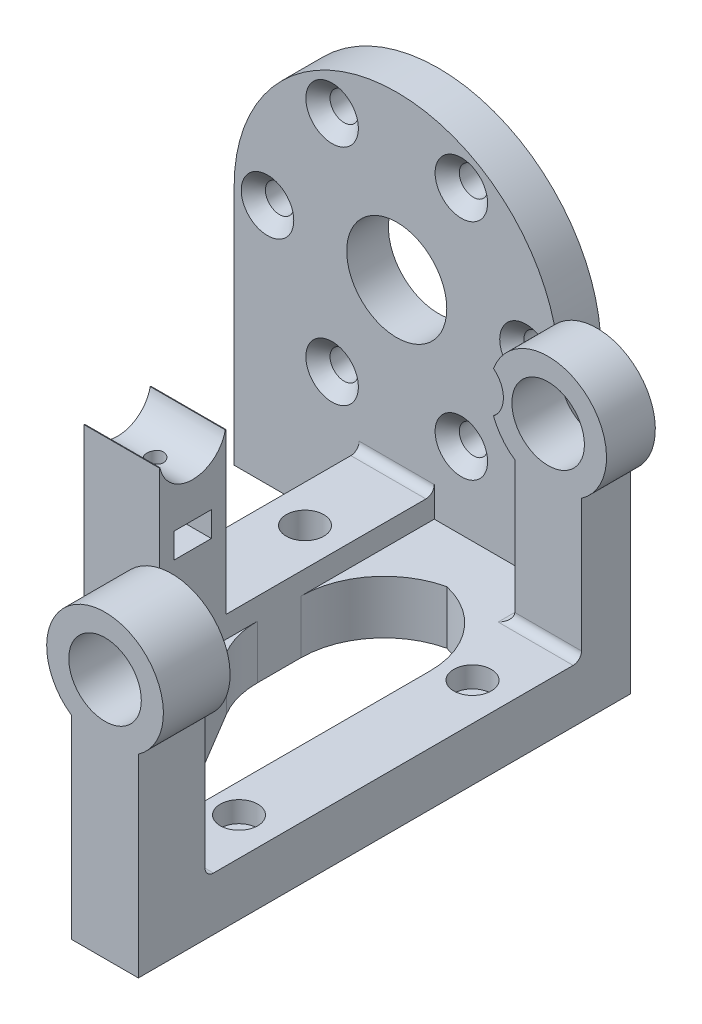
from build123d import *

# Parameters (mm, degrees)
SKETCH5_R                                       = 19.5
SKETCH5_R_2                                     = 1.5
SKETCH5_R_3                                     = 6
BOSS_EXTRUDE1_DEPTH                             = 5
CSK_FOR_M3_FLAT_HEAD_MACHINE_SCREW1_D           = 3.4
CSK_FOR_M3_FLAT_HEAD_MACHINE_SCREW1_CSINK_D     = 6.3
CSK_FOR_M3_FLAT_HEAD_MACHINE_SCREW1_CSINK_ANGLE = 90
BOSS_EXTRUDE2_START                             = -5
BOSS_EXTRUDE2_DEPTH                             = 5
SKETCH9_W                                       = 9
SKETCH9_H                                       = 5
BOSS_EXTRUDE3_DEPTH                             = 32.98166783
SKETCH10_W                                      = 9
SKETCH10_H                                      = 8
BOSS_EXTRUDE4_DEPTH                             = 24
CUT_EXTRUDE1_DEPTH                              = 20
SKETCH12_R                                      = 1
CUT_EXTRUDE2_DEPTH                              = 16
CUT_EXTRUDE3_START                              = -9
SKETCH13_W                                      = 4.5
SKETCH13_H                                      = 3
CUT_EXTRUDE3_DEPTH                              = 9
BOSS_EXTRUDE5_DEPTH                             = 2.4
SKETCH15_W                                      = 8
SKETCH15_H                                      = 26.6
BOSS_EXTRUDE6_DEPTH                             = 8
CUT_EXTRUDE4_REACH                              = 76.201
CUT_EXTRUDE5_REACH                              = 83.567
SKETCH17_W                                      = 8
SKETCH17_H                                      = 3
BOSS_EXTRUDE7_DEPTH                             = 2.4
FILLET1_R                                       = 10
FILLET2_R                                       = 1
FILLET3_R                                       = 1
BOSS_EXTRUDE8_START                             = -5.858134929
BOSS_EXTRUDE8_DEPTH                             = 5.858134929
BOSS_EXTRUDE9_DEPTH                             = 8
CUT_EXTRUDE9_REACH                              = 77.385
SKETCH26_R                                      = 4.35
BOSS_EXTRUDE10_START                            = 4
BOSS_EXTRUDE10_DEPTH                            = 4
SKETCH28_R                                      = 1
CUT_EXTRUDE10_DEPTH                             = 83.645869552
SKETCH29_R                                      = 2.25
CUT_EXTRUDE11_DEPTH                             = 2.5
SKETCH30_R                                      = 1
CUT_EXTRUDE12_DEPTH                             = 82.352195754
SKETCH31_R                                      = 2.25
CUT_EXTRUDE13_DEPTH                             = 5


with BuildPart() as part:
    # Sketch5 → Boss-Extrude1 (new body)
    with BuildSketch(Plane.XY):
        Circle(SKETCH5_R)
        with Locations((-7.75, 13.423393759)):
            Circle(SKETCH5_R_2, mode=Mode.SUBTRACT)
        Circle(SKETCH5_R_3, mode=Mode.SUBTRACT)
        with Locations((7.75, 13.423393759)):
            Circle(SKETCH5_R_2, mode=Mode.SUBTRACT)
        with Locations((15.5, 0)):
            Circle(SKETCH5_R_2, mode=Mode.SUBTRACT)
        with Locations((7.75, -13.423393759)):
            Circle(SKETCH5_R_2, mode=Mode.SUBTRACT)
        with Locations((-7.75, -13.423393759)):
            Circle(SKETCH5_R_2, mode=Mode.SUBTRACT)
        with Locations((-15.5, 0)):
            Circle(SKETCH5_R_2, mode=Mode.SUBTRACT)
    extrude(amount=BOSS_EXTRUDE1_DEPTH)

    # CSK for M3 Flat Head Machine Screw1 (through all)
    with Locations(Plane.XY.offset(5)):
        with Locations((-15.5, 0), (-7.75, 13.423393759), (7.75, 13.423393759), (15.5, 0), (7.75, -13.423393759), (-7.75, -13.423393759)):
            CounterSinkHole(CSK_FOR_M3_FLAT_HEAD_MACHINE_SCREW1_D / 2, CSK_FOR_M3_FLAT_HEAD_MACHINE_SCREW1_CSINK_D / 2, counter_sink_angle=CSK_FOR_M3_FLAT_HEAD_MACHINE_SCREW1_CSINK_ANGLE)

    # Sketch8 → Boss-Extrude2 (add)
    with BuildSketch(Plane.XY.offset(5).offset(BOSS_EXTRUDE2_START)):
        with BuildLine():
            Line((-19.5, 0), (-19.5, -25))
            Line((-19.5, -25), (19.5, -25))
            Line((19.5, -25), (19.5, 0))
            ThreePointArc((19.5, 0), (0, -19.5), (-19.5, 0))
        make_face()
    extrude(amount=BOSS_EXTRUDE2_DEPTH)

    # Sketch9 → Boss-Extrude3 (add)
    with BuildSketch(Plane.XY.offset(5)):
        with Locations((0, -22.5)):
            Rectangle(SKETCH9_W, SKETCH9_H)
    extrude(amount=BOSS_EXTRUDE3_DEPTH)

    # Sketch10 → Boss-Extrude4 (add)
    with BuildSketch(Plane(origin=(0.371235249, -20, 0), x_dir=(1, 0, 0), z_dir=(0, 1, 0))):
        with Locations((-0.371235249, -33.98166783)):
            Rectangle(SKETCH10_W, SKETCH10_H)
    extrude(amount=BOSS_EXTRUDE4_DEPTH)

    # Sketch11 → Cut-Extrude1 (cut)
    with BuildSketch(Plane.ZY.offset(4.5)):
        with BuildLine():
            Line((29.98166783, 0), (27.136883472, 2.082164772))
            Line((27.136883472, 2.082164772), (27.357366889, 4.848229459))
            Line((27.357366889, 4.848229459), (32.749188635, 5.469591817))
            Line((32.749188635, 5.469591817), (41.448261638, 5.028624983))
            Line((41.448261638, 5.028624983), (40.823718291, 2.383004911))
            Line((40.823718291, 2.383004911), (37.98166783, 0))
            Line((37.98166783, 0), (37.98166783, -0.8))
            Line((37.98166783, -0.8), (37.900851418, -0.8))
            ThreePointArc((37.900851418, -0.8), (33.98166783, -4), (30.062484242, -0.8))
            Line((30.062484242, -0.8), (29.98166783, -0.8))
            Line((29.98166783, -0.8), (29.98166783, 0))
        make_face()
    extrude(amount=-CUT_EXTRUDE1_DEPTH, mode=Mode.SUBTRACT)

    # Sketch12 → Cut-Extrude2 (cut)
    with BuildSketch(Plane(origin=(0, -0.8, 0), x_dir=(1, 0, 0), z_dir=(0, 1, 0))):
        with Locations(Location((0, -33.98166783, 0), (0, 0, 180))):
            Circle(SKETCH12_R)
    extrude(amount=-CUT_EXTRUDE2_DEPTH, mode=Mode.SUBTRACT)

    # Sketch13 → Cut-Extrude3 (cut)
    with BuildSketch(Plane.ZY.offset(4.5).offset(CUT_EXTRUDE3_START)):
        with Locations((33.98166783, -9.74430731)):
            Rectangle(SKETCH13_W, SKETCH13_H)
    extrude(amount=CUT_EXTRUDE3_DEPTH, mode=Mode.SUBTRACT)

    # Sketch14 → Boss-Extrude5 (add)
    with BuildSketch(Plane.XZ.offset(25)):
        Polygon((4.5, 5), (28.014992407, 5), (28.014992407, 12.492055485), (28.014992407, 64), (20.014992407, 64), (20.014992407, 11), (4.5, 11), align=None)
    extrude(amount=-BOSS_EXTRUDE5_DEPTH)

    # Sketch15 → Boss-Extrude6 (add)
    with BuildSketch(Plane(origin=(28.014992407, 0, 0), x_dir=(0, 0, -1), z_dir=(1, 0, 0))):
        with Locations((-60, -9.3)):
            Rectangle(SKETCH15_W, SKETCH15_H)
        with Locations((-9, -9.3)):
            Rectangle(SKETCH15_W, SKETCH15_H)
    extrude(amount=-BOSS_EXTRUDE6_DEPTH)

    # Cut-Extrude4: up to this face of the body (flat: up to its plane)
    cut_extrude4_end = Plane(part.part.faces().sort_by_distance((23.992430761, -10.570480367, 5))[0])
    # Sketch16 → Cut-Extrude4 (cut, up to the picked face)
    with BuildSketch(Plane.XY.offset(64), mode=Mode.PRIVATE) as cut_extrude4_sk1:
        with BuildLine():
            Line((20.014992407, -1.0579315), (20.157430879, -1.0579315))
            ThreePointArc((20.157430879, -1.0579315), (24.014992407, -4), (27.872553935, -1.0579315))
            Line((27.872553935, -1.0579315), (28.014992407, -1.0579315))
            Line((28.014992407, -1.0579315), (30.979685938, 0.908889408))
            Line((30.979685938, 0.908889408), (30.041869507, 7.8055779))
            Line((30.041869507, 7.8055779), (20.014992407, 9.247594016))
            Line((20.014992407, 9.247594016), (20.014992407, -1.0579315))
        make_face()
    cut_extrude4_tool1 = split(extrude(cut_extrude4_sk1.sketch, amount=-CUT_EXTRUDE4_REACH, mode=Mode.PRIVATE), bisect_by=cut_extrude4_end, keep=Keep.BOTH, mode=Mode.PRIVATE)
    add(cut_extrude4_tool1.solids().sort_by(Axis((24.887523, 2.893806, 64), (0, 0, -1)))[0], mode=Mode.SUBTRACT)

    # Cut-Extrude5: up to this face of the body (flat: up to its plane)
    cut_extrude5_end = Plane(part.part.faces().sort_by_distance((20.086211643, -1.0579315, 9))[0])
    # Sketch17 → Cut-Extrude5 (cut, up to the picked face)
    with BuildSketch(Plane(origin=(0, -22.6, 0), x_dir=(1, 0, 0), z_dir=(0, 1, 0)), mode=Mode.PRIVATE) as cut_extrude5_sk1:
        with Locations((24.014992407, -12.358134929)):
            Rectangle(SKETCH17_W, SKETCH17_H)
    cut_extrude5_tool1 = split(extrude(cut_extrude5_sk1.sketch, amount=CUT_EXTRUDE5_REACH, mode=Mode.PRIVATE), bisect_by=cut_extrude5_end, keep=Keep.BOTH, mode=Mode.PRIVATE)
    add(cut_extrude5_tool1.solids().sort_by(Axis((24.014992, -22.6, 12.358135), (0, 1, 0)))[0], mode=Mode.SUBTRACT)

    # Sketch20 → Boss-Extrude7 (add)
    with BuildSketch(Plane(origin=(0, -22.6, 0), x_dir=(1, 0, 0), z_dir=(0, 1, 0))):
        Polygon((20.014992407, -64), (4.5, -37.98166783), (4.5, -28.98166783), (20.014992407, -55), align=None)
    extrude(amount=-BOSS_EXTRUDE7_DEPTH)

    # Fillet1
    # the kernel refuses this fillet: 10 mm, written as the material it adds along each edge
    with BuildSketch(Plane(origin=(4.5, -25, 11), x_dir=(0, 0, 1), z_dir=(0, 1, 0)), Plane(origin=(20.014992407, -25, 11), x_dir=(-1, 0, 0), z_dir=(0, 1, 0))) as fillet1_piece_1:
        with BuildLine():
            CenterArc((FILLET1_R, FILLET1_R), FILLET1_R, 180, 90)
            Line((0, FILLET1_R), (0, 0))
            Line((0, 0), (FILLET1_R, 0))
        make_face()
    extrude(amount=2.4)
    with BuildSketch(Plane(origin=(4.5, -22.6, 28.98166783), x_dir=(0, 0, -1), z_dir=(0, -1, 0))) as fillet1_piece_2:
        with BuildLine():
            CenterArc((FILLET1_R * 0.275521450238, FILLET1_R), FILLET1_R, 239.191952284, 30.808047716)
            Line((-FILLET1_R * 0.236642058357, FILLET1_R * 0.141112032647), (0, 0))
            Line((0, 0), (FILLET1_R * 0.275521450238, 0))
        make_face()
    extrude(amount=2.4)

    # Fillet2
    fillet2_edges = [part.edges().sort_by_distance(p)[0] for p in [
        (20.014992407, -23.8, 55),
    ]]
    fillet(fillet2_edges, radius=FILLET2_R)

    # Fillet3
    # the kernel refuses this fillet: 1 mm, written as the material it adds along each edge
    with BuildSketch(Plane(origin=(28.014992407, -22.6, 56), x_dir=(0, 0, -1), z_dir=(-1, 0, 0))) as fillet3_piece_1:
        with BuildLine():
            CenterArc((FILLET3_R, -FILLET3_R), FILLET3_R, 90, 90)
            Line((0, -FILLET3_R), (0, 0))
            Line((0, 0), (FILLET3_R, 0))
        make_face()
    extrude(amount=8)
    with BuildSketch(Plane(origin=(20.014992407, -22.6, 5), x_dir=(-1, 0, 0), z_dir=(0, 0, 1))) as fillet3_piece_2:
        with BuildLine():
            CenterArc((FILLET3_R, -FILLET3_R), FILLET3_R, 90, 90)
            Line((0, -FILLET3_R), (0, 0))
            Line((0, 0), (FILLET3_R, 0))
        make_face()
    extrude(amount=5.858134929)
    with BuildSketch(Plane(origin=(28.014992407, -22.6, 10.858134929), x_dir=(0, 0, 1), z_dir=(-1, 0, 0))) as fillet3_piece_3:
        with BuildLine():
            CenterArc((FILLET3_R, FILLET3_R), FILLET3_R, 180, 90)
            Line((0, FILLET3_R), (0, 0))
            Line((0, 0), (FILLET3_R, 0))
        make_face()
    extrude(amount=8)
    with BuildSketch(Plane(origin=(20.014992407, -22.6, 56), x_dir=(-1, 0, 0), z_dir=(0, 0, 1))) as fillet3_piece_4_section:
        with BuildLine():
            CenterArc((FILLET3_R, -FILLET3_R), FILLET3_R, 90, 90)
            Line((0, -FILLET3_R), (0, 0))
            Line((0, 0), (FILLET3_R, 0))
        make_face()
    fillet3_piece_4 = extrude(amount=8, mode=Mode.PRIVATE)
    fillet3_piece_4 = split(fillet3_piece_4, bisect_by=Plane(origin=(18.118657623, -22.367607941, 60.81988447), z_dir=(0.8588879673530325, 0, -0.5121635085948395)), keep=Keep.TOP, mode=Mode.PRIVATE)
    add(fillet3_piece_4)
    with BuildSketch(Plane(origin=(4.5, -20, 5), x_dir=(0, 1, 0), z_dir=(-1, 0, 0))) as fillet3_piece_5:
        with BuildLine():
            CenterArc((FILLET3_R, -FILLET3_R), FILLET3_R, 90, 90)
            Line((0, -FILLET3_R), (0, 0))
            Line((0, 0), (FILLET3_R, 0))
        make_face()
    extrude(amount=9)
    with BuildSketch(Plane(origin=(20.014992407, -22.6, 53.5), x_dir=(-1, 0, 0), z_dir=(0, 0, 1))) as fillet3_piece_6a_section:
        with BuildLine():
            CenterArc((FILLET3_R, -FILLET3_R), FILLET3_R, 90, 90)
            Line((0, -FILLET3_R), (0, 0))
            Line((0, 0), (FILLET3_R, 0))
        make_face()
    fillet3_piece_6a = extrude(amount=10.5, mode=Mode.PRIVATE)
    fillet3_piece_6a = split(fillet3_piece_6a, bisect_by=Plane(origin=(19.788597293, -22.373604886, 56), z_dir=(0, 0, -1)), keep=Keep.TOP, mode=Mode.PRIVATE)
    with BuildSketch(Plane(origin=(28.014992407, -22.6, 56), x_dir=(0, 0, -1), z_dir=(-1, 0, 0))) as fillet3_piece_6b_section:
        with BuildLine():
            CenterArc((FILLET3_R, -FILLET3_R), FILLET3_R, 90, 90)
            Line((0, -FILLET3_R), (0, 0))
            Line((0, 0), (FILLET3_R, 0))
        make_face()
    fillet3_piece_6b = extrude(amount=10.5, mode=Mode.PRIVATE)
    fillet3_piece_6b = split(fillet3_piece_6b, bisect_by=Plane(origin=(20.014992407, -22.373604886, 55.773604886), z_dir=(-1, 0, 0)), keep=Keep.TOP, mode=Mode.PRIVATE)
    fillet3_piece_6 = fillet3_piece_6a & fillet3_piece_6b
    add(fillet3_piece_6)
    with BuildSketch(Plane(origin=(20.014992407, -22.6, 5), x_dir=(-1, 0, 0), z_dir=(0, 0, 1))) as fillet3_piece_7a_section:
        with BuildLine():
            CenterArc((FILLET3_R, -FILLET3_R), FILLET3_R, 90, 90)
            Line((0, -FILLET3_R), (0, 0))
            Line((0, 0), (FILLET3_R, 0))
        make_face()
    fillet3_piece_7a = extrude(amount=8.358134929, mode=Mode.PRIVATE)
    fillet3_piece_7a = split(fillet3_piece_7a, bisect_by=Plane(origin=(19.788597293, -22.373604886, 10.858134929), z_dir=(0, 0, 1)), keep=Keep.TOP, mode=Mode.PRIVATE)
    with BuildSketch(Plane(origin=(28.014992407, -22.6, 10.858134929), x_dir=(0, 0, 1), z_dir=(-1, 0, 0))) as fillet3_piece_7b_section:
        with BuildLine():
            CenterArc((FILLET3_R, FILLET3_R), FILLET3_R, 180, 90)
            Line((0, FILLET3_R), (0, 0))
            Line((0, 0), (FILLET3_R, 0))
        make_face()
    fillet3_piece_7b = extrude(amount=10.5, mode=Mode.PRIVATE)
    fillet3_piece_7b = split(fillet3_piece_7b, bisect_by=Plane(origin=(20.014992407, -22.373604886, 11.084530043), z_dir=(-1, 0, 0)), keep=Keep.TOP, mode=Mode.PRIVATE)
    fillet3_piece_7 = fillet3_piece_7a & fillet3_piece_7b
    add(fillet3_piece_7)

    # Sketch24 → Boss-Extrude8 (add)
    with BuildSketch(Plane(origin=(0, 0, 5), x_dir=(-1, 0, 0), z_dir=(0, 0, -1)).offset(BOSS_EXTRUDE8_START)):
        with BuildLine():
            Line((-20.014992407, -5.744562647), (-20.014992407, -1.0579315))
            Line((-20.014992407, -1.0579315), (-20.157430879, -1.0579315))
            ThreePointArc((-20.157430879, -1.0579315), (-24.014992407, 4), (-27.872553935, -1.0579315))
            Line((-27.872553935, -1.0579315), (-28.014992407, -1.0579315))
            Line((-28.014992407, -1.0579315), (-28.014992407, -5.744562647))
            ThreePointArc((-28.014992407, -5.744562647), (-28.312909665, 5.525206534), (-17.462867029, 2.463666582))
            ThreePointArc((-17.462867029, 2.463666582), (-18.65, 0), (-17.462867029, -2.463666582))
            ThreePointArc((-17.462867029, -2.463666582), (-18.489785873, -4.297917258), (-20.014992407, -5.744562647))
        make_face()
    extrude(amount=BOSS_EXTRUDE8_DEPTH)

    # Sketch25 → Boss-Extrude9 (add)
    with BuildSketch(Plane.XY.offset(64)):
        with BuildLine():
            Line((20.014992407, -5.744562647), (20.014992407, -1.0579315))
            Line((20.014992407, -1.0579315), (20.157430879, -1.0579315))
            ThreePointArc((20.157430879, -1.0579315), (24.014992407, 4), (27.872553935, -1.0579315))
            Line((27.872553935, -1.0579315), (28.014992407, -1.0579315))
            Line((28.014992407, -1.0579315), (28.014992407, -5.744562647))
            ThreePointArc((28.014992407, -5.744562647), (24.014992407, 7), (20.014992407, -5.744562647))
        make_face()
    extrude(amount=-BOSS_EXTRUDE9_DEPTH)

    # Cut-Extrude9: up to this face of the body (flat: up to its plane)
    cut_extrude9_end = Plane(part.part.faces().sort_by_distance((24.401043924, -10.02174873, 5))[0])
    # Sketch26 → Cut-Extrude9 (cut, up to the picked face)
    with BuildSketch(Plane.XY.offset(64), mode=Mode.PRIVATE) as cut_extrude9_sk1:
        with Locations((24.014992407, 0)):
            Circle(SKETCH26_R)
    cut_extrude9_tool1 = split(extrude(cut_extrude9_sk1.sketch, amount=-CUT_EXTRUDE9_REACH, mode=Mode.PRIVATE), bisect_by=cut_extrude9_end, keep=Keep.BOTH, mode=Mode.PRIVATE)
    add(cut_extrude9_tool1.solids().sort_by(Axis((24.014992, 0, 64), (0, 0, -1)))[0], mode=Mode.SUBTRACT)

    # Sketch27 → Boss-Extrude10 (add)
    with BuildSketch(Plane.XZ.offset(25).offset(BOSS_EXTRUDE10_START)):
        Polygon((19.5, 0), (19.5, 5), (28.014992407, 5), (28.014992407, 64), (20.014992407, 64), (4.5, 37.98166783), (-4.5, 37.98166783), (-4.5, 5), (-19.5, 5), (-19.5, 0), align=None)
        with BuildLine():
            Line((4.5, 26.226453328), (4.5, 21))
            ThreePointArc((4.5, 21), (6.67615702, 14.772040381), (12.257496204, 11.25468437))
            ThreePointArc((12.257496204, 11.25468437), (17.838835387, 14.772040381), (20.014992407, 21))
            Line((20.014992407, 21), (20.014992407, 51.370518524))
            ThreePointArc((20.014992407, 51.370518524), (19.280616232, 52.334595276), (18.15610444, 51.882682032))
            Line((18.15610444, 51.882682032), (5.911120326, 31.348088414))
            ThreePointArc((5.911120326, 31.348088414), (4.85923248, 28.882691576), (4.5, 26.226453328))
        make_face(mode=Mode.SUBTRACT)
    extrude(amount=-BOSS_EXTRUDE10_DEPTH)

    # Sketch28 → Cut-Extrude10 (cut, through all)
    with BuildSketch(Plane(origin=(0, -22.6, 0), x_dir=(1, 0, 0), z_dir=(0, 1, 0))):
        with Locations(Location((23.514992407, -19.429067464, 0), (0, 0, 270))):
            Circle(SKETCH28_R)
        with Locations(Location((23.514992407, -47.429067464, 0), (0, 0, 270))):
            Circle(SKETCH28_R)
    extrude(amount=-CUT_EXTRUDE10_DEPTH, mode=Mode.SUBTRACT)

    # Sketch29 → Cut-Extrude11 (cut)
    with BuildSketch(Plane(origin=(0, -22.6, 0), x_dir=(1, 0, 0), z_dir=(0, 1, 0))):
        with Locations(Location((23.514992407, -19.429067464, 0), (0, 0, 270))):
            Circle(SKETCH29_R)
        with Locations(Location((23.514992407, -47.429067464, 0), (0, 0, 270))):
            Circle(SKETCH29_R)
    extrude(amount=-CUT_EXTRUDE11_DEPTH, mode=Mode.SUBTRACT)

    # Sketch30 → Cut-Extrude12 (cut, through all)
    with BuildSketch(Plane(origin=(0, -20, 0), x_dir=(1, 0, 0), z_dir=(0, 1, 0))):
        with Locations(Location((0, -16, 0), (0, 0, 270))):
            Circle(SKETCH30_R)
    extrude(amount=-CUT_EXTRUDE12_DEPTH, mode=Mode.SUBTRACT)

    # Sketch31 → Cut-Extrude13 (cut)
    with BuildSketch(Plane(origin=(0, -20, 0), x_dir=(1, 0, 0), z_dir=(0, 1, 0))):
        with Locations(Location((0, -16, 0), (0, 0, 270))):
            Circle(SKETCH31_R)
    extrude(amount=-CUT_EXTRUDE13_DEPTH, mode=Mode.SUBTRACT)


solid = part.part
